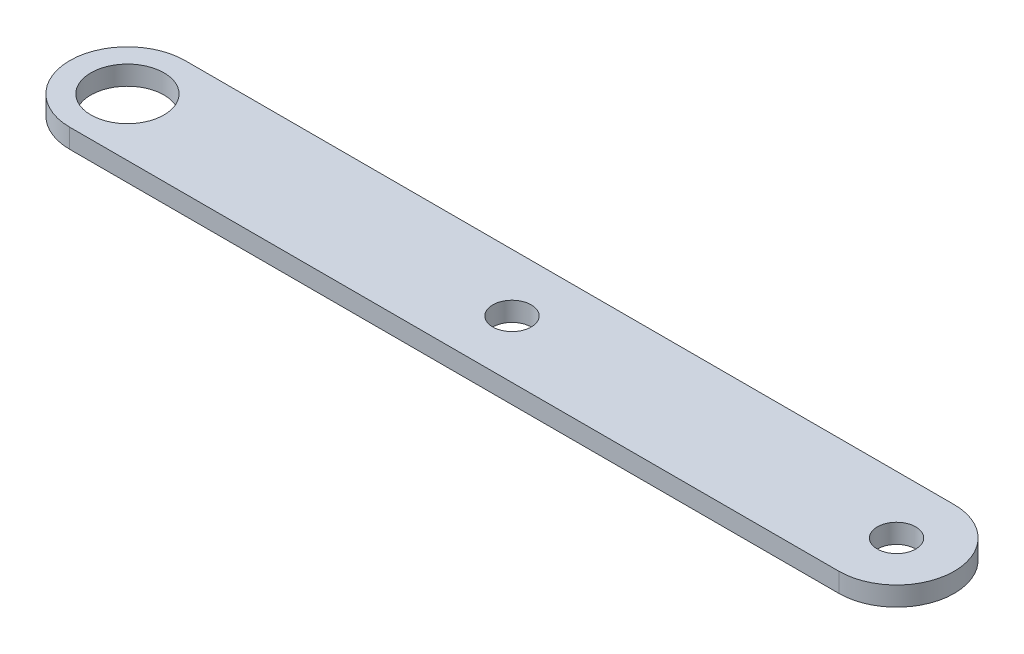
from build123d import *

# Parameters (mm, degrees)
SKETCH_1_R      = 5
SKETCH_1_R_2    = 9.5
EXTRUDE_1_DEPTH = 5


with BuildPart() as part:
    # 草图1 → 凸台-拉伸1 (new body)
    with BuildSketch(Plane(origin=(0, 0, 0), x_dir=(1, 0, 0), z_dir=(0, 1, 0))):
        with BuildLine():
            Line((0, 15), (200, 15))
            ThreePointArc((200, 15), (215, 0), (200, -15))
            Line((200, -15), (0, -15))
            ThreePointArc((0, -15), (-15, 0), (0, 15))
        make_face()
        with Locations((200, 0)):
            Circle(SKETCH_1_R, mode=Mode.SUBTRACT)
        with Locations((100, 0)):
            Circle(SKETCH_1_R, mode=Mode.SUBTRACT)
        Circle(SKETCH_1_R_2, mode=Mode.SUBTRACT)
    extrude(amount=EXTRUDE_1_DEPTH)


solid = part.part
